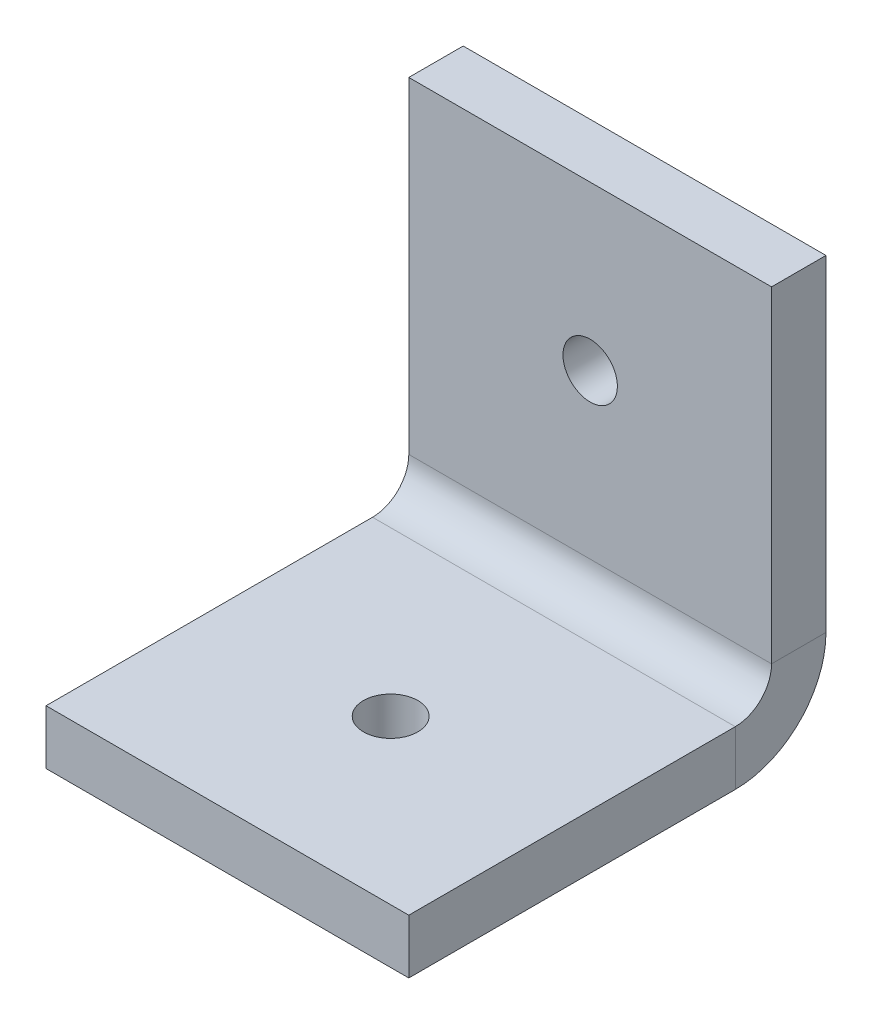
from build123d import *

# Parameters (mm, degrees)
BASE_FLANGE1_DEPTH = 20
SKETCH6_R          = 1.5
CUT_EXTRUDE1_DEPTH = 10
SKETCH7_R          = 1.5
CUT_EXTRUDE2_DEPTH = 3


# Sheet-metal steps are written as plain solids
with BuildPart() as part:
    # Sketch1 → Base-Flange1 (new body)
    with BuildSketch(Plane(origin=(0, 0, 0), x_dir=(0, 0, -1), z_dir=(1, 0, 0))):
        with BuildLine():
            Line((0, 20), (0, 2))
            ThreePointArc((0, 2), (-0.585786438, 0.585786438), (-2, 0))
            Line((-2, 0), (-20, 0))
            Line((-20, 0), (-20, -3))
            Line((-20, -3), (-2, -3))
            ThreePointArc((-2, -3), (1.535533906, -1.535533906), (3, 2))
            Line((3, 2), (3, 20))
            Line((3, 20), (0, 20))
        make_face()
    extrude(amount=BASE_FLANGE1_DEPTH)

    # Sketch6 → Cut-Extrude1 (cut)
    with BuildSketch(Plane(origin=(0, 0, -3), x_dir=(-1, 0, 0), z_dir=(0, 0, -1))):
        with Locations(Location((-10, 11, 0), (0, 0, 90))):
            Circle(SKETCH6_R)
    extrude(amount=-CUT_EXTRUDE1_DEPTH, mode=Mode.SUBTRACT)

    # Sketch7 → Cut-Extrude2 (cut)
    with BuildSketch(Plane.XZ.offset(3)):
        with Locations(Location((10, 11, 0), (0, 0, 270))):
            Circle(SKETCH7_R)
    extrude(amount=-CUT_EXTRUDE2_DEPTH, mode=Mode.SUBTRACT)


solid = part.part
